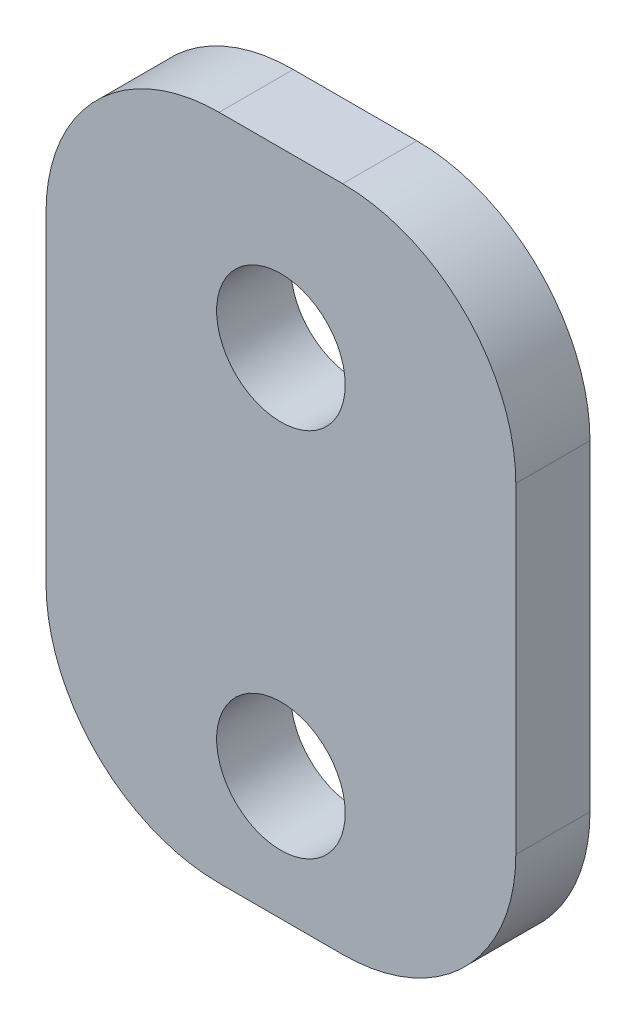
from build123d import *

# Parameters (mm, degrees)
SKETCH1_R          = 2.6
BASE_FLANGE1_DEPTH = 3
FILLET1_R          = 7


# Sheet-metal steps are written as plain solids
with BuildPart() as part:
    # Sketch1 → Base-Flange1 (new body)
    with BuildSketch(Plane.XY):
        with BuildLine():
            Line((-9.5, -13), (-9.5, -33))
            ThreePointArc((-9.5, -33), (-7.449747468, -37.949747468), (-2.5, -40))
            Line((-2.5, -40), (2.5, -40))
            ThreePointArc((2.5, -40), (7.449747468, -37.949747468), (9.5, -33))
            Line((9.5, -33), (9.5, -13))
            Line((9.5, -13), (-9.5, -13))
        make_face()
        with Locations((0, -35)):
            Circle(SKETCH1_R, mode=Mode.SUBTRACT)
        with Locations((0, -20)):
            Circle(SKETCH1_R, mode=Mode.SUBTRACT)
    extrude(amount=-BASE_FLANGE1_DEPTH)

    # Fillet1
    fillet1_edges = [part.edges().sort_by_distance(p)[0] for p in [
        (9.5, -13, -1.5),
        (-9.5, -13, -1.5),
    ]]
    fillet(fillet1_edges, radius=FILLET1_R)


solid = part.part
